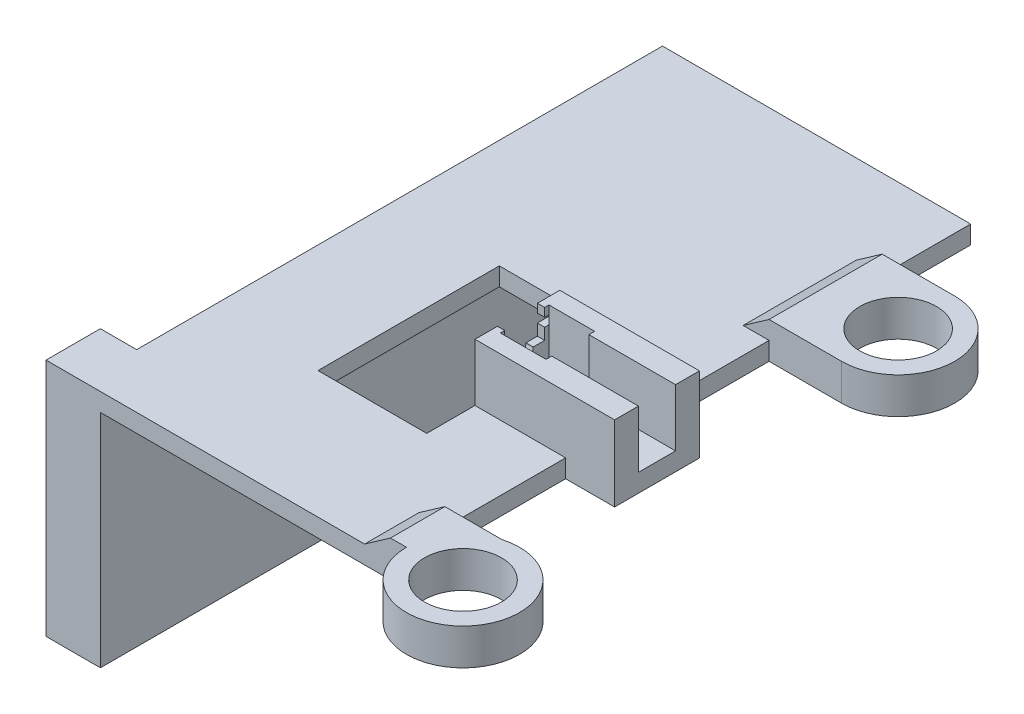
from build123d import *
from OCP.BRepFilletAPI import BRepFilletAPI_MakeChamfer

# Parameters (mm, degrees)
SKETCH1_W                 = 101.6
SKETCH1_H                 = 152.4
BOSS_EXTRUDE1_DEPTH       = 6.35
SKETCH2_W                 = 38.1
SKETCH2_H                 = 63.5
CUT_EXTRUDE1_DEPTH        = 92.800885072
BOSS_EXTRUDE3_DEPTH       = 10.0965
BOSS_EXTRUDE3_DEPTH_BACK  = 6.35
CUT_EXTRUDE2_REACH        = 105.862
SKETCH6_R                 = 3
SKETCH7_W                 = 24.005
SKETCH7_H                 = 2.009
BOSS_EXTRUDE4_DEPTH       = 16.4465
BOSS_EXTRUDE5_REACH       = 129.401
SKETCH10_W                = 13
SKETCH10_H                = 6.35
CUT_EXTRUDE3_REACH        = 138.165
SKETCH11_W                = 13
SKETCH11_H                = 10.0965
BOSS_EXTRUDE6_DEPTH       = 10
CUT_EXTRUDE4_DEPTH        = 2.54
SKETCH14_W                = 101.6
SKETCH14_H                = 6.35
BOSS_EXTRUDE7_DEPTH       = 50.8
SKETCH15_W                = 19.05
SKETCH15_H                = 19.05
BOSS_EXTRUDE8_DEPTH       = 77.47
SKETCH16_W                = 19.05
SKETCH16_H                = 19.05
BOSS_EXTRUDE9_DEPTH       = 6.35
SKETCH17_W                = 184.15
SKETCH17_H                = 83.82
BOSS_EXTRUDE10_DEPTH      = 6.35
BOSS_EXTRUDE11_DEPTH      = 6.35
BOSS_EXTRUDE11_DEPTH_BACK = 6.35
SKETCH18_R                = 19.812
SKETCH18_R_2              = 13.462
SKETCH21_W                = 7.62
SKETCH21_H                = 39.624
BOSS_EXTRUDE13_DEPTH      = 12.7
CHAMFER1_SIZE             = 6.35
CHAMFER1_SIZE_2           = 9.068739843


with BuildPart() as part:
    # Sketch1 → Boss-Extrude1 (new body)
    with BuildSketch(Plane(origin=(0, 0, 0), x_dir=(1, 0, 0), z_dir=(0, 1, 0))):
        Rectangle(SKETCH1_W, SKETCH1_H)
    extrude(amount=-BOSS_EXTRUDE1_DEPTH)

    # Sketch2 → Cut-Extrude1 (cut, through all)
    with BuildSketch(Plane(origin=(0, 0, 0), x_dir=(1, 0, 0), z_dir=(0, 1, 0))):
        Rectangle(SKETCH2_W, SKETCH2_H)
    extrude(amount=-CUT_EXTRUDE1_DEPTH, mode=Mode.SUBTRACT)

    # Sketch4 → Boss-Extrude3 (add, two sides: drawn at the far end of the back side and taken through both)
    with BuildSketch(Plane(origin=(0, 0, 0), x_dir=(1, 0, 0), z_dir=(0, 1, 0)).offset(-BOSS_EXTRUDE3_DEPTH_BACK)):
        Polygon((61.595, -8.509), (50.8, -8.509), (50.8, -14.859), (67.945, -14.859), (67.945, 14.859), (50.8, 14.859), (50.8, 8.509), (61.595, 8.509), align=None)
        Polygon((50.8, -8.509), (21.59, -8.509), (21.59, 8.509), (50.8, 8.509), (50.8, 14.859), (19.05, 14.859), (19.05, -14.859), (50.8, -14.859), align=None)
    extrude(amount=BOSS_EXTRUDE3_DEPTH + BOSS_EXTRUDE3_DEPTH_BACK)

    # Sketch6 → Cut-Extrude2 (cut, up to next)
    with BuildSketch(Plane.ZY.offset(-19.05), mode=Mode.PRIVATE) as cut_extrude2_sk1:
        with Locations((0, 10.0965)):
            Circle(SKETCH6_R)
    cut_extrude2_tool1 = extrude(cut_extrude2_sk1.sketch, amount=-CUT_EXTRUDE2_REACH, mode=Mode.PRIVATE) & part.part
    add(cut_extrude2_tool1.solids().sort_by_distance((19.05, 10.0965, 0))[0], mode=Mode.SUBTRACT)

    # Sketch7 → Boss-Extrude4 (add, through all)
    with BuildSketch(Plane(origin=(0, 10.0965, 0), x_dir=(1, 0, 0), z_dir=(0, 1, 0))):
        with Locations((49.5925, 7.5045)):
            Rectangle(SKETCH7_W, SKETCH7_H)
        with Locations((49.5925, -7.5045)):
            Rectangle(SKETCH7_W, SKETCH7_H)
    extrude(amount=-BOSS_EXTRUDE4_DEPTH)

    # Sketch10 → Boss-Extrude5 (add, up to next)
    with BuildSketch(Plane(origin=(50.8, 0, 0), x_dir=(0, 0, -1), z_dir=(1, 0, 0)), mode=Mode.PRIVATE) as boss_extrude5_sk1:
        with Locations((0, -3.175)):
            Rectangle(SKETCH10_W, SKETCH10_H)
    boss_extrude5_tool1 = extrude(boss_extrude5_sk1.sketch, amount=BOSS_EXTRUDE5_REACH, mode=Mode.PRIVATE) - part.part
    add(boss_extrude5_tool1.solids().sort_by_distance((50.8, -3.175, 0))[0])

    # Sketch11 → Cut-Extrude3 (cut, up to next)
    with BuildSketch(Plane.ZY.offset(-61.595), mode=Mode.PRIVATE) as cut_extrude3_sk1:
        with Locations((0, 5.04825)):
            Rectangle(SKETCH11_W, SKETCH11_H)
    cut_extrude3_tool1 = extrude(cut_extrude3_sk1.sketch, amount=-CUT_EXTRUDE3_REACH, mode=Mode.PRIVATE) & part.part
    add(cut_extrude3_tool1.solids().sort_by_distance((61.595, 5.04825, 0))[0], mode=Mode.SUBTRACT)

    # Sketch12 → Boss-Extrude6 (add)
    with BuildSketch(Plane(origin=(0, 10.0965, 0), x_dir=(1, 0, 0), z_dir=(0, 1, 0))):
        Polygon((67.945, -14.859), (67.945, -6.5), (37.59, -6.5), (37.59, -8.509), (21.59, -8.509), (21.59, -3), (19.05, -3), (19.05, -14.859), align=None)
        Polygon((37.59, 6.5), (67.945, 6.5), (67.945, 14.859), (19.05, 14.859), (19.05, 3), (21.59, 3), (21.59, 8.509), (37.59, 8.509), align=None)
    extrude(amount=BOSS_EXTRUDE6_DEPTH)

    # Sketch13 → Cut-Extrude4 (cut)
    with BuildSketch(Plane.ZY.offset(-19.05)):
        Polygon((3, 10.0965), (7, 10.0965), (7, 14.0965), (11, 14.0965), (11, 17.0965), (7, 17.0965), (7, 20.0965), (3, 20.0965), align=None)
    cut_extrude4 = extrude(amount=-CUT_EXTRUDE4_DEPTH, mode=Mode.SUBTRACT)

    # Mirror1: Cut-Extrude4 across plane
    add(cut_extrude4.mirror(Plane.XY), mode=Mode.SUBTRACT)

    # Sketch14 → Boss-Extrude7 (add)
    with BuildSketch(Plane(origin=(0, 0, -76.2), x_dir=(-1, 0, 0), z_dir=(0, 0, -1))):
        with Locations((0, -3.175)):
            Rectangle(SKETCH14_W, SKETCH14_H)
    extrude(amount=BOSS_EXTRUDE7_DEPTH)

    # Sketch15 → Boss-Extrude8 (add)
    with BuildSketch(Plane.XZ.offset(6.35)):
        with Locations((-60.325, 66.675)):
            Rectangle(SKETCH15_W, SKETCH15_H)
        with Locations((-41.275, -117.475)):
            Rectangle(SKETCH15_W, SKETCH15_H)
    extrude(amount=BOSS_EXTRUDE8_DEPTH)


with BuildPart() as boss_extrude8_piece_1:
    # of the separate pieces the step leaves, piece 1, a body of its own (boss_extrude8_pieces)
    add(part.part.solids().sort_by_distance((-50.8, 0, 76.2))[0])



with BuildPart() as boss_extrude8_piece_2:
    # of the separate pieces the step leaves, piece 2, a body of its own (boss_extrude8_pieces)
    add(part.part.solids().sort_by_distance((-50.8, -83.82, 76.2))[0])


with BuildPart() as boss_extrude8_piece_1_1:
    add(boss_extrude8_piece_1.part)

    add(boss_extrude8_piece_2.part)  # Boss-Extrude9 merges Boss-Extrude8 piece 2
    # Sketch16 → Boss-Extrude9 (add)
    with BuildSketch(Plane(origin=(0, -6.35, 0), x_dir=(1, 0, 0), z_dir=(0, 1, 0))):
        with Locations((-60.325, -66.675)):
            Rectangle(SKETCH16_W, SKETCH16_H)
    extrude(amount=BOSS_EXTRUDE9_DEPTH)

    # Sketch17 → Boss-Extrude10 (add)
    with BuildSketch(Plane.ZY.offset(50.8)):
        with Locations((-34.925, -41.91)):
            Rectangle(SKETCH17_W, SKETCH17_H)
    extrude(amount=BOSS_EXTRUDE10_DEPTH)

    # Sketch18 → Boss-Extrude11 (add, two sides: drawn at the far end of the back side and taken through both)
    # profile 1 of 2: a face of its own
    with BuildSketch(Plane(origin=(0, 0, 0), x_dir=(1, 0, 0), z_dir=(0, 1, 0)).offset(-BOSS_EXTRUDE11_DEPTH_BACK)):
        with Locations(Location((76.2, -76.2, 0), (0, 0, 270))):
            Circle(SKETCH18_R)
        with Locations(Location((76.2, -76.2, 0), (0, 0, 270))):
            Circle(SKETCH18_R_2, mode=Mode.SUBTRACT)
    # profile 2 of 2: a face of its own
    with BuildSketch(Plane(origin=(0, 0, 0), x_dir=(1, 0, 0), z_dir=(0, 1, 0)).offset(-BOSS_EXTRUDE11_DEPTH_BACK)):
        with BuildLine():
            Line((76.2, 96.012), (50.8, 96.012))
            Line((50.8, 96.012), (50.8, 56.388))
            Line((50.8, 56.388), (76.2, 56.388))
            ThreePointArc((76.2, 56.388), (96.012, 76.2), (76.2, 96.012))
        make_face()
        with Locations(Location((76.2, 76.2, 0), (0, 0, 270))):
            Circle(SKETCH18_R_2, mode=Mode.SUBTRACT)
    extrude(amount=BOSS_EXTRUDE11_DEPTH + BOSS_EXTRUDE11_DEPTH_BACK)


with BuildPart() as boss_extrude11_piece_1:
    # of the separate pieces the step leaves, piece 1, a body of its own (boss_extrude11_pieces)
    add(boss_extrude8_piece_1_1.part.solids().sort_by_distance((-50.8, -6.35, 76.2))[0])



with BuildPart() as boss_extrude11_piece_2:
    # of the separate pieces the step leaves, piece 2, a body of its own (boss_extrude11_pieces)
    add(boss_extrude8_piece_1_1.part.solids().sort_by_distance((76.2, 0, 96.012))[0])


with BuildPart() as boss_extrude11_piece_1_1:
    add(boss_extrude11_piece_1.part)

    add(boss_extrude11_piece_2.part)  # Boss-Extrude13 merges Boss-Extrude11 piece 2
    # Sketch21 → Boss-Extrude13 (add)
    with BuildSketch(Plane(origin=(0, 6.35, 0), x_dir=(1, 0, 0), z_dir=(0, 1, 0))):
        with BuildLine():
            Line((56.388, -76.2), (50.8, -76.2))
            Line((50.8, -76.2), (50.8, -57.15))
            Line((50.8, -57.15), (70.758231537, -57.15))
            ThreePointArc((70.758231537, -57.15), (60.383431776, -64.268884645), (56.388, -76.2))
        make_face()
        with Locations((54.61, 76.2)):
            Rectangle(SKETCH21_W, SKETCH21_H)
    extrude(amount=-BOSS_EXTRUDE13_DEPTH)

    # Chamfer1
    chamfer1_edges_1 = [boss_extrude11_piece_1_1.edges().sort_by_distance(p)[0] for p in [
        (50.8, 0, 66.675),
    ]]
    chamfer1_side_1 = [boss_extrude11_piece_1_1.faces().sort_by_distance(p)[0] for p in [
        (50.8, 0.127, 66.675),
    ]]
    chamfer1_edges_2 = [boss_extrude11_piece_1_1.edges().sort_by_distance(p)[0] for p in [
        (50.8, 0, -76.2),
    ]]
    chamfer1_side_2 = [boss_extrude11_piece_1_1.faces().sort_by_distance(p)[0] for p in [
        (50.673, 0, -76.2),
    ]]
    chamfer1 = BRepFilletAPI_MakeChamfer(boss_extrude11_piece_1_1.part.solid().wrapped)
    for e in chamfer1_edges_1:
        chamfer1.Add(CHAMFER1_SIZE - 0.0001, CHAMFER1_SIZE_2 - 0.0001, e.wrapped, chamfer1_side_1[0].wrapped)
    for e in chamfer1_edges_2:
        chamfer1.Add(CHAMFER1_SIZE_2 - 0.0001, CHAMFER1_SIZE - 0.0001, e.wrapped, chamfer1_side_2[0].wrapped)
    add(Compound.cast(chamfer1.Shape()), mode=Mode.REPLACE)  # a hair under: the kernel refuses the full size


solid = boss_extrude11_piece_1_1.part
